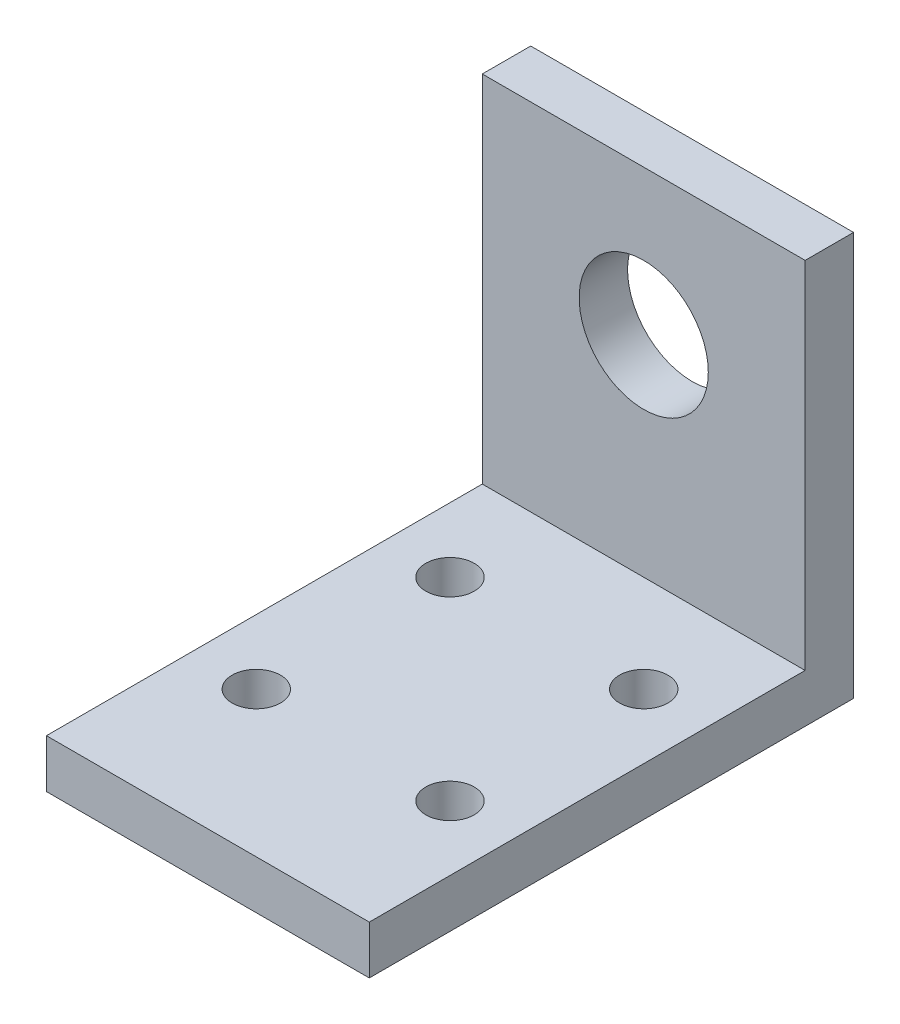
from build123d import *

# Parameters (mm, degrees)
EXTRUDE_1_DEPTH     = 20
CUT_EXTRUDE_1_REACH = 47.924
SKETCH_2_R          = 4
CUT_EXTRUDE_2_REACH = 47.924
SKETCH_3_R          = 1.5
SKETCH_4_W          = 20
SKETCH_4_H          = 8
CUT_EXTRUDE_3_DEPTH = 10
SKETCH_5_R          = 1.5
CUT_EXTRUDE_4_DEPTH = 10


with BuildPart() as part:
    # 草图1 → 凸台-拉伸1 (new body)
    with BuildSketch(Plane(origin=(0, 0, 0), x_dir=(0, 0, -1), z_dir=(1, 0, 0))):
        Polygon((0, 0), (0, 22), (3, 22), (3, -3), (-35, -3), (-35, 0), align=None)
    extrude(amount=EXTRUDE_1_DEPTH)

    # 草图2 → 切除-拉伸1 (cut, up to next)
    with BuildSketch(Plane.XY, mode=Mode.PRIVATE) as cut_extrude_1_sk1:
        with Locations((10, 13)):
            Circle(SKETCH_2_R)
    cut_extrude_1_tool1 = extrude(cut_extrude_1_sk1.sketch, amount=-CUT_EXTRUDE_1_REACH, mode=Mode.PRIVATE) & part.part
    add(cut_extrude_1_tool1.solids().sort_by_distance((10, 13, 0))[0], mode=Mode.SUBTRACT)

    # 草图3 → 切除-拉伸2 (cut, up to next)
    with BuildSketch(Plane(origin=(0, 0, 0), x_dir=(1, 0, 0), z_dir=(0, 1, 0)), mode=Mode.PRIVATE) as cut_extrude_2_sk1:
        with Locations((4, -6)):
            Circle(SKETCH_3_R)
    cut_extrude_2_tool1 = extrude(cut_extrude_2_sk1.sketch, amount=-CUT_EXTRUDE_2_REACH, mode=Mode.PRIVATE) & part.part
    # 草图3 → 切除-拉伸2 (cut, up to next)
    with BuildSketch(Plane(origin=(0, 0, 0), x_dir=(1, 0, 0), z_dir=(0, 1, 0)), mode=Mode.PRIVATE) as cut_extrude_2_sk2:
        with Locations((16, -6)):
            Circle(SKETCH_3_R)
    cut_extrude_2_tool2 = extrude(cut_extrude_2_sk2.sketch, amount=-CUT_EXTRUDE_2_REACH, mode=Mode.PRIVATE) & part.part
    add(cut_extrude_2_tool1.solids().sort_by_distance((4, 0, 6))[0], mode=Mode.SUBTRACT)
    add(cut_extrude_2_tool2.solids().sort_by_distance((16, 0, 6))[0], mode=Mode.SUBTRACT)

    # 草图4 → 切除-拉伸3 (cut)
    with BuildSketch(Plane.XZ.offset(3)):
        with Locations((10, 31)):
            Rectangle(SKETCH_4_W, SKETCH_4_H)
    extrude(amount=-CUT_EXTRUDE_3_DEPTH, mode=Mode.SUBTRACT)

    # 草图5 → 切除-拉伸4 (cut)
    with BuildSketch(Plane.XZ.offset(3)):
        with Locations((16, 18)):
            Circle(SKETCH_5_R)
        with Locations((4, 18)):
            Circle(SKETCH_5_R)
    extrude(amount=-CUT_EXTRUDE_4_DEPTH, mode=Mode.SUBTRACT)


solid = part.part
